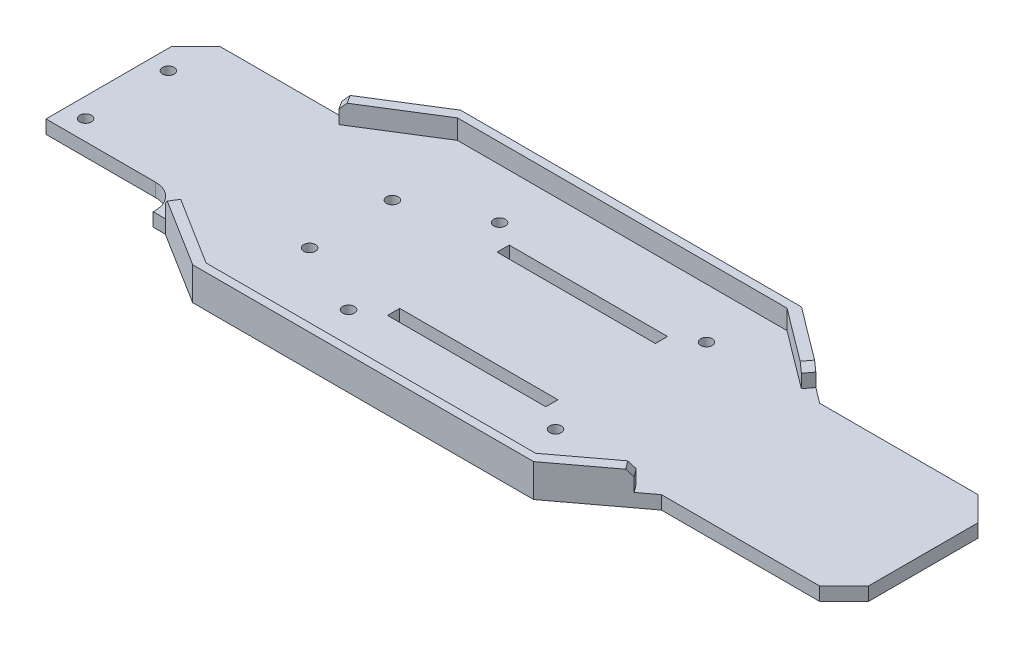
from build123d import *

# Parameters (mm, degrees)
BOSS_EXTRUDE1_DEPTH  = 5.5
CHASSIS_WALLS1_DEPTH = 8
CHAMFER1_SIZE        = 10
CHAMFER2_SIZE        = 10
CHAMFER3_SIZE        = 2.5
SKETCH4_R            = 2.4
CUT_EXTRUDE1_DEPTH   = 10
SKETCH5_W            = 55
SKETCH5_H            = 11
CUT_EXTRUDE2_DEPTH   = 10
SKETCH6_W            = 65
SKETCH6_H            = 5
CUT_EXTRUDE3_DEPTH   = 184.613724977
FILLET1_R            = 10


with BuildPart() as part:
    # Sketch1 → Boss-Extrude1 (new body)
    with BuildSketch(Plane(origin=(0, 0, 0), x_dir=(1, 0, 0), z_dir=(0, 1, 0))):
        Polygon((-100, 36.25), (-70, 55), (70, 55), (100, 32.5), (175, 32.5), (175, -32.5), (100, -32.5), (70, -55), (-70, -55), (-100, -36.25), (-160, -36.25), (-160, 36.25), align=None)
    extrude(amount=BOSS_EXTRUDE1_DEPTH)

    # Sketch3 → Chassis-Walls1 (add)
    with BuildSketch(Plane(origin=(0, 5.5, 0), x_dir=(1, 0, 0), z_dir=(0, 1, 0))):
        Polygon((0, 55), (-70, 55), (-100, 36.25), (-97.88000424, 32.858006784), (-67.88000424, 51.608006784), (0, 51.608006784), (67.456005088, 51.608006784), (91.056005088, 33.908006784), (93.6, 37.3), (70, 55), align=None)
        Polygon((67.456005088, -51.608006784), (0, -51.608006784), (-67.88000424, -51.608006784), (-97.88000424, -32.858006784), (-100, -36.25), (-70, -55), (0, -55), (70, -55), (93.6, -37.3), (91.056005088, -33.908006784), align=None)
    extrude(amount=CHASSIS_WALLS1_DEPTH)

    # Chamfer1
    chamfer1_edges = [part.edges().sort_by_distance(p)[0] for p in [
        (-160, 2.75, -36.25),
        (-160, 2.75, 36.25),
    ]]
    chamfer(chamfer1_edges, length=CHAMFER1_SIZE)

    # Chamfer2
    chamfer2_edges = [part.edges().sort_by_distance(p)[0] for p in [
        (175, 2.75, -32.5),
        (175, 2.75, 32.5),
    ]]
    chamfer(chamfer2_edges, length=CHAMFER2_SIZE)

    # Chamfer3
    chamfer3_edges = [part.edges().sort_by_distance(p)[0] for p in [
        (-98.94000212, 13.5, -34.554003392),
        (92.328002544, 13.5, -35.604003392),
        (-98.94000212, 13.5, 34.554003392),
        (92.328002544, 13.5, 35.604003392),
    ]]
    chamfer(chamfer3_edges, length=CHAMFER3_SIZE)

    # Sketch4 → Cut-Extrude1 (cut)
    with BuildSketch(Plane.XZ):
        with Locations((-152, 17)):
            Circle(SKETCH4_R)
        with Locations((-60, 17)):
            Circle(SKETCH4_R)
        with Locations((-60, -17)):
            Circle(SKETCH4_R)
        with Locations((-152, -17)):
            Circle(SKETCH4_R)
        with Locations((-30, 31)):
            Circle(SKETCH4_R)
        with Locations((55, 31)):
            Circle(SKETCH4_R)
        with Locations((55, -31)):
            Circle(SKETCH4_R)
        with Locations((-30, -31)):
            Circle(SKETCH4_R)
    extrude(amount=-CUT_EXTRUDE1_DEPTH, mode=Mode.SUBTRACT)

    # Sketch5 → Cut-Extrude2 (cut)
    with BuildSketch(Plane(origin=(0, 5.5, 0), x_dir=(1, 0, 0), z_dir=(0, 1, 0))):
        with Locations((-132.5, -30.75)):
            Rectangle(SKETCH5_W, SKETCH5_H)
    extrude(amount=-CUT_EXTRUDE2_DEPTH, mode=Mode.SUBTRACT)

    # Sketch6 → Cut-Extrude3 (cut, through all)
    with BuildSketch(Plane(origin=(0, 5.5, 0), x_dir=(1, 0, 0), z_dir=(0, 1, 0))):
        with Locations((12.5, 22.5)):
            Rectangle(SKETCH6_W, SKETCH6_H)
        with Locations((12.5, -22.5)):
            Rectangle(SKETCH6_W, SKETCH6_H)
    extrude(amount=-CUT_EXTRUDE3_DEPTH, mode=Mode.SUBTRACT)

    # Fillet1
    fillet1_edges = [part.edges().sort_by_distance(p)[0] for p in [
        (-105, 2.75, 25.25),
    ]]
    fillet(fillet1_edges, radius=FILLET1_R)


solid = part.part
